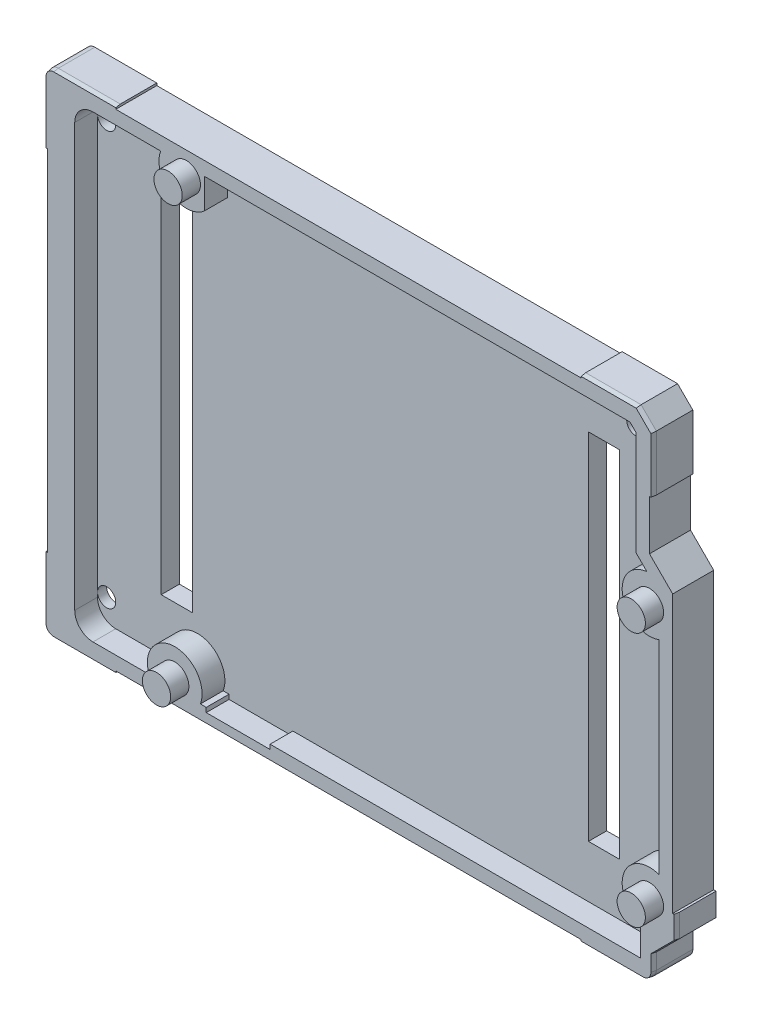
from build123d import *

# Parameters (mm, degrees)
BOSS_EXTRUDE1_START    = 3
SKETCH2_W              = 3.408239977
SKETCH2_H              = 38.899803488
BOSS_EXTRUDE1_DEPTH    = 2
BOSS_EXTRUDE2_START    = 0.5
BOSS_EXTRUDE2_DEPTH    = 4.5
BOSS_EXTRUDE3_START    = 0.5
SKETCH2_5_R            = 1.55
BOSS_EXTRUDE3_DEPTH    = 2
CHAMFER1_SIZE          = 0.1
CHAMFER1_SIZE2         = 0.5
SKETCH4_R              = 3.5
SKETCH4_R_2            = 1
CUT_EXTRUDE2_DEPTH     = 1
SKETCH4_3_R            = 1
CUT_EXTRUDE3_DEPTH     = 131.276716191
CUT_EXTRUDE4_START     = -0.1
CUT_EXTRUDE4_OUTLINE_W = 3.200622545
CUT_EXTRUDE4_OUTLINE_H = 1.015319288
CUT_EXTRUDE4_DEPTH     = 0.1
SKETCH6_W              = 51.040013568
SKETCH6_H              = 0.25
SKETCH6_W_2            = 0.25
SKETCH6_H_2            = 38.343270923
CUT_EXTRUDE5_DEPTH     = 131.276716313


# Read off the part's stored shape, not the designer's step: Cut-Extrude4
with BuildPart() as part:
    # Sketch2 → Boss-Extrude1 (new body)
    with BuildSketch(Plane(origin=(0, 0, 0), x_dir=(-1, 0, 0), z_dir=(0, 0, -1)).offset(BOSS_EXTRUDE1_START)):
        with BuildLine():
            ThreePointArc((-67.919679801, -18.097456736), (-70.732628511, -14.054710577), (-73.545577222, -18.097456736))
            Line((-73.545577222, -18.097456736), (-74.187108273, -18.097456736))
            Line((-74.187108273, -18.097456736), (-74.187108273, -18.597456736))
            Line((-74.187108273, -18.597456736), (-81.187108273, -18.597456736))
            Line((-81.187108273, -18.597456736), (-81.187108273, -18.097456736))
            Line((-81.187108273, -18.097456736), (-121.802642079, -18.097456736))
            Line((-121.802642079, -18.097456736), (-121.802642079, -14.803142498))
            ThreePointArc((-121.802642079, -14.803142498), (-119.981755466, -10.953595861), (-123.84481438, -9.161554233))
            Line((-123.84481438, -9.161554233), (-123.84481438, 13.152133079))
            ThreePointArc((-123.84481438, 13.152133079), (-119.877527751, 15.299117116), (-122.523862626, 18.952309608))
            Line((-122.523862626, 18.952309608), (-121.302642079, 20.173530155))
            Line((-121.302642079, 20.173530155), (-121.302642079, 31.599188818))
            Line((-121.302642079, 31.599188818), (-120.656018993, 32.245814187))
            Line((-120.656018993, 32.245814187), (-74.002628511, 32.245814187))
            Line((-74.002628511, 32.245814187), (-74.002628511, 28.969221446))
            ThreePointArc((-74.002628511, 28.969221446), (-70.314561309, 28.725283552), (-69.188857338, 32.245814187))
            Line((-69.188857338, 32.245814187), (-61.762628511, 32.245814187))
            ThreePointArc((-61.762628511, 32.245814187), (-60.348414949, 31.660027749), (-59.762628511, 30.245814187))
            Line((-59.762628511, 30.245814187), (-59.762628511, -16.097456736))
            ThreePointArc((-59.762628511, -16.097456736), (-60.348414949, -17.511670298), (-61.762628511, -18.097456736))
            Line((-61.762628511, -18.097456736), (-67.919679801, -18.097456736))
        make_face()
        with Locations((-115.31029451, 7.081240142)):
            Rectangle(SKETCH2_W, SKETCH2_H, mode=Mode.SUBTRACT)
        with Locations((-68.449565127, 7.081240142)):
            Rectangle(SKETCH2_W, SKETCH2_H, mode=Mode.SUBTRACT)
    extrude(amount=BOSS_EXTRUDE1_DEPTH)

    # Sketch2<3> → Boss-Extrude2 (add)
    with BuildSketch(Plane(origin=(0, 0, 0), x_dir=(-1, 0, 0), z_dir=(0, 0, -1)).offset(BOSS_EXTRUDE2_START)):
        with BuildLine():
            Line((-57.462628511, -19.847456736), (-122.102642079, -19.847456736))
            ThreePointArc((-122.102642079, -19.847456736), (-122.774393521, -19.569208178), (-123.052642079, -18.897456736))
            Line((-123.052642079, -18.897456736), (-123.052642079, -17.158837169))
            Line((-123.052642079, -17.158837169), (-125.59481438, -14.616663544))
            Line((-125.59481438, -14.616663544), (-125.59481438, 18.356231588))
            Line((-125.59481438, 18.356231588), (-123.052642079, 20.898403889))
            Line((-123.052642079, 20.898403889), (-123.052642079, 32.324060743))
            Line((-123.052642079, 32.324060743), (-121.380894537, 33.995814187))
            Line((-121.380894537, 33.995814187), (-57.462628511, 33.995814187))
            ThreePointArc((-57.462628511, 33.995814187), (-56.790877069, 33.717565629), (-56.512628511, 33.045814187))
            Line((-56.512628511, 33.045814187), (-56.512628511, -18.897456736))
            ThreePointArc((-56.512628511, -18.897456736), (-56.790877069, -19.569208178), (-57.462628511, -19.847456736))
        make_face()
        with BuildLine():
            Line((-61.762628511, 32.245814187), (-69.188857338, 32.245814187))
            ThreePointArc((-69.188857338, 32.245814187), (-70.314561309, 28.725283552), (-74.002628511, 28.969221446))
            Line((-74.002628511, 28.969221446), (-74.002628511, 32.245814187))
            Line((-74.002628511, 32.245814187), (-120.656018993, 32.245814187))
            Line((-120.656018993, 32.245814187), (-121.302642079, 31.599188818))
            Line((-121.302642079, 31.599188818), (-121.302642079, 20.173530155))
            Line((-121.302642079, 20.173530155), (-122.523862626, 18.952309608))
            ThreePointArc((-122.523862626, 18.952309608), (-119.877527751, 15.299117116), (-123.84481438, 13.152133079))
            Line((-123.84481438, 13.152133079), (-123.84481438, -9.161554233))
            ThreePointArc((-123.84481438, -9.161554233), (-119.981755466, -10.953595861), (-121.802642079, -14.803142498))
            Line((-121.802642079, -14.803142498), (-121.802642079, -18.097456736))
            Line((-121.802642079, -18.097456736), (-81.187108273, -18.097456736))
            Line((-81.187108273, -18.097456736), (-81.187108273, -18.597456736))
            Line((-81.187108273, -18.597456736), (-74.187108273, -18.597456736))
            Line((-74.187108273, -18.597456736), (-74.187108273, -18.097456736))
            Line((-74.187108273, -18.097456736), (-73.545577222, -18.097456736))
            ThreePointArc((-73.545577222, -18.097456736), (-70.732628511, -14.054710577), (-67.919679801, -18.097456736))
            Line((-67.919679801, -18.097456736), (-61.762628511, -18.097456736))
            ThreePointArc((-61.762628511, -18.097456736), (-60.348414949, -17.511670298), (-59.762628511, -16.097456736))
            Line((-59.762628511, -16.097456736), (-59.762628511, 30.245814187))
            ThreePointArc((-59.762628511, 30.245814187), (-60.348414949, 31.660027749), (-61.762628511, 32.245814187))
        make_face(mode=Mode.SUBTRACT)
    extrude(amount=BOSS_EXTRUDE2_DEPTH)

    # Sketch2<5> → Boss-Extrude3 (add)
    with BuildSketch(Plane(origin=(0, 0, 0), x_dir=(-1, 0, 0), z_dir=(0, 0, -1)).offset(BOSS_EXTRUDE3_START)):
        with Locations((-70.732628511, -17.054710577)):
            Circle(SKETCH2_5_R)
        with Locations((-122.802628511, -11.974710577)):
            Circle(SKETCH2_5_R)
        with Locations((-122.802628511, 15.965289423)):
            Circle(SKETCH2_5_R)
        with Locations((-72.002628511, 31.205289423)):
            Circle(SKETCH2_5_R)
    extrude(amount=-BOSS_EXTRUDE3_DEPTH)

    # Chamfer1
    chamfer1_edges = [part.edges().sort_by_distance(p)[0] for p in [
        (56.512628511, 7.074178726, -0.5),
        (56.790877069, 33.717565629, -0.5),
        (89.421761524, 33.995814187, -0.5),
        (122.216768308, 33.159937465, -0.5),
        (123.052642079, 26.611232316, -0.5),
        (124.32372823, 19.627317738, -0.5),
        (124.32372823, -15.887750356, -0.5),
        (123.052642079, -18.028146952, -0.5),
        (122.774393521, -19.569208178, -0.5),
        (56.790877069, -19.569208178, -0.5),
        (89.782635295, -19.847456736, -0.5),
        (125.59481438, 1.869784022, -0.5),
    ]]
    chamfer1_side = [part.faces().sort_by_distance(p)[0] for p in [
        (89.782635295, -18.97158881, -0.5),
    ]]
    chamfer(chamfer1_edges, length=CHAMFER1_SIZE, length2=CHAMFER1_SIZE2, reference=chamfer1_side[0])

    # Sketch4 → Cut-Extrude2 (cut)
    # profile 1 of 4: a face of its own
    with BuildSketch(Plane(origin=(0, 0, -5), x_dir=(-1, 0, 0), z_dir=(0, 0, -1))):
        with Locations((-118.802642079, 29.745814187)):
            Circle(SKETCH4_R)
        with Locations((-118.802642079, 29.745814187)):
            Circle(SKETCH4_R_2, mode=Mode.SUBTRACT)
    # profile 2 of 4: a face of its own
    with BuildSketch(Plane(origin=(0, 0, -5), x_dir=(-1, 0, 0), z_dir=(0, 0, -1))):
        with Locations((-60.762628511, 29.745814187)):
            Circle(SKETCH4_R)
        with Locations((-60.762628511, 29.745814187)):
            Circle(SKETCH4_R_2, mode=Mode.SUBTRACT)
    # profile 3 of 4: a face of its own
    with BuildSketch(Plane(origin=(0, 0, -5), x_dir=(-1, 0, 0), z_dir=(0, 0, -1))):
        with Locations((-60.762628511, -15.597456736)):
            Circle(SKETCH4_R)
        with Locations((-60.762628511, -15.597456736)):
            Circle(SKETCH4_R_2, mode=Mode.SUBTRACT)
    # profile 4 of 4: a face of its own
    with BuildSketch(Plane(origin=(0, 0, -5), x_dir=(-1, 0, 0), z_dir=(0, 0, -1))):
        with Locations((-118.802642079, -15.597456736)):
            Circle(SKETCH4_R)
        with Locations((-118.802642079, -15.597456736)):
            Circle(SKETCH4_R_2, mode=Mode.SUBTRACT)
    extrude(amount=-CUT_EXTRUDE2_DEPTH, mode=Mode.SUBTRACT)

    # Sketch4<3> → Cut-Extrude3 (cut, through all)
    with BuildSketch(Plane(origin=(0, 0, -5), x_dir=(-1, 0, 0), z_dir=(0, 0, -1))):
        with Locations((-118.802642079, 29.745814187)):
            Circle(SKETCH4_3_R)
        with Locations((-60.762628511, 29.745814187)):
            Circle(SKETCH4_3_R)
        with Locations((-60.762628511, -15.597456736)):
            Circle(SKETCH4_3_R)
        with Locations((-118.802642079, -15.597456736)):
            Circle(SKETCH4_3_R)
    extrude(amount=-CUT_EXTRUDE3_DEPTH, mode=Mode.SUBTRACT)

    # Cut-Extrude4 outline → Cut-Extrude4 (cut)
    # profile 1 of 3: a face of its own
    with BuildSketch(Plane(origin=(0, 0, -5), x_dir=(-1, 0, 0), z_dir=(0, 0, -1)).offset(CUT_EXTRUDE4_START)):
        with BuildLine():
            add(Edge.make_bspline(
                [(-91.879929818, 5.301013002), (-91.713250685, 5.05794433), (-91.340054452, 4.557222914), (-90.708052769, 3.842822143), (-89.973499097, 3.149696588), (-89.230729326, 2.635640492), (-88.566264307, 2.314810671), (-87.85216143, 2.069269468), (-86.966399982, 1.927397867), (-85.9097155, 1.915127625), (-84.813745024, 2.115417445), (-83.806418452, 2.537988583), (-83.041670905, 3.042729563), (-82.495530725, 3.560532924), (-82.023393492, 4.125901619), (-81.551856108, 4.899563642), (-81.23558079, 5.769800557), (-81.105349302, 6.507352899), (-81.085572249, 6.890959615), (-81.088140807, 7.081240145)],
                knots=[0.104390575, 0.104390575, 0.104390575, 0.104390575, 0.162006879, 0.226402489, 0.290798099, 0.355193708, 0.387391513, 0.419589318, 0.483984927, 0.548380537, 0.612776147, 0.677171756, 0.741567366, 0.773765171, 0.805962976, 0.870358585, 0.934754195, 0.966952, 0.999149805, 0.999149805, 0.999149805, 0.999149805], degree=3))
            add(Edge.make_bspline(
                [(-81.088140807, 7.081240145), (-81.08557225, 7.271520675), (-81.105349302, 7.65512739), (-81.23558079, 8.392679733), (-81.551856109, 9.262916648), (-82.023393494, 10.03657867), (-82.495530727, 10.601947365), (-83.041670908, 11.119750726), (-83.806418455, 11.624491705), (-84.813745027, 12.047062842), (-85.909715503, 12.247352661), (-86.966399986, 12.235082419), (-87.852161433, 12.093210818), (-88.56626431, 11.847669614), (-89.230729329, 11.526839792), (-89.9734991, 11.012783696), (-90.708052772, 10.319658141), (-91.340054453, 9.60525737), (-91.713250686, 9.104535954), (-91.879929818, 8.861467283)],
                knots=[-0.03117995, -0.03117995, -0.03117995, -0.03117995, 0.001017855, 0.03321566, 0.09761127, 0.162006879, 0.194204684, 0.226402489, 0.290798099, 0.355193708, 0.419589318, 0.483984927, 0.548380537, 0.580578342, 0.612776147, 0.677171756, 0.741567366, 0.805962976, 0.86357928, 0.86357928, 0.86357928, 0.86357928], degree=3))
            add(Edge.make_bspline(
                [(-91.879929818, 8.861467283), (-92.046608951, 9.104535954), (-92.419805183, 9.60525737), (-93.051806865, 10.319658141), (-93.786360536, 11.012783696), (-94.529130307, 11.526839792), (-95.193595327, 11.847669613), (-95.907698204, 12.093210818), (-96.793459651, 12.235082419), (-97.850144133, 12.247352661), (-98.946114609, 12.047062842), (-99.953441182, 11.624491705), (-100.718188728, 11.119750726), (-101.264328909, 10.601947365), (-101.736466143, 10.03657867), (-102.208003527, 9.262916648), (-102.524278846, 8.392679733), (-102.654510334, 7.65512739), (-102.674287387, 7.271520675), (-102.671718829, 7.081240145)],
                knots=[0.104390575, 0.104390575, 0.104390575, 0.104390575, 0.162006879, 0.226402489, 0.290798099, 0.355193708, 0.387391513, 0.419589318, 0.483984927, 0.548380537, 0.612776147, 0.677171756, 0.741567366, 0.773765171, 0.805962976, 0.870358585, 0.934754195, 0.966952, 0.999149805, 0.999149805, 0.999149805, 0.999149805], degree=3))
            add(Edge.make_bspline(
                [(-102.671718829, 7.081240145), (-102.674287387, 6.890959614), (-102.654510335, 6.507352899), (-102.524278847, 5.769800557), (-102.208003529, 4.899563641), (-101.736466144, 4.125901619), (-101.264328911, 3.560532924), (-100.718188731, 3.042729562), (-99.953441184, 2.537988583), (-98.946114612, 2.115417445), (-97.850144136, 1.915127625), (-96.793459654, 1.927397867), (-95.907698207, 2.069269468), (-95.19359533, 2.314810671), (-94.52913031, 2.635640492), (-93.786360539, 3.149696588), (-93.051806867, 3.842822143), (-92.419805184, 4.557222914), (-92.046608951, 5.05794433), (-91.879929818, 5.301013002)],
                knots=[-0.03117995, -0.03117995, -0.03117995, -0.03117995, 0.001017855, 0.03321566, 0.09761127, 0.162006879, 0.194204684, 0.226402489, 0.290798099, 0.355193708, 0.419589318, 0.483984927, 0.548380537, 0.580578342, 0.612776147, 0.677171756, 0.741567366, 0.805962976, 0.86357928, 0.86357928, 0.86357928, 0.86357928], degree=3))
        make_face()
        with BuildLine():
            add(Edge.make_bspline(
                [(-100.871487153, 7.081240142), (-100.871536386, 7.07833104), (-100.87168791, 7.069318558), (-100.872520605, 7.021124128), (-100.871455856, 6.910493686), (-100.856835343, 6.702338799), (-100.798051885, 6.325678204), (-100.624144549, 5.796477525), (-100.280132446, 5.185004458), (-99.848849782, 4.668641648), (-99.325155173, 4.26738537), (-98.694041594, 3.949881939), (-98.049615841, 3.766838333), (-97.357881067, 3.71080866), (-96.618232253, 3.767321832), (-95.9776606, 3.925789013), (-95.376480646, 4.228132078), (-94.806562629, 4.656376401), (-94.255861361, 5.193790714), (-93.577829752, 5.978803356), (-93.144131127, 6.628013319), (-92.894065857, 7.081240142)],
                knots=[0.034722485, 0.034722485, 0.034722485, 0.034722485, 0.035521766, 0.036054621, 0.049821598, 0.064920711, 0.095118936, 0.155515388, 0.215911839, 0.276308291, 0.336704742, 0.397101194, 0.457497645, 0.517894097, 0.578290548, 0.638687, 0.699083451, 0.759479903, 0.819876354, 0.880272806, 1.001065709, 1.001065709, 1.001065709, 1.001065709], degree=3))
            add(Edge.make_bspline(
                [(-92.894065857, 7.081240142), (-93.144131127, 7.534466964), (-93.577829752, 8.183676927), (-94.255861361, 8.96868957), (-94.806562629, 9.506103883), (-95.376480646, 9.934348206), (-95.9776606, 10.23669127), (-96.618232253, 10.395158451), (-97.357881067, 10.451671623), (-98.049615841, 10.39564195), (-98.694041594, 10.212598345), (-99.325155173, 9.895094913), (-99.848849782, 9.493838636), (-100.280132446, 8.977475825), (-100.624144549, 8.366002758), (-100.798051885, 7.836802079), (-100.856835343, 7.460141485), (-100.871455856, 7.251986598), (-100.872520605, 7.141356156), (-100.87168791, 7.093161725), (-100.871536386, 7.084149244), (-100.871487153, 7.081240142)],
                knots=[0.034722485, 0.034722485, 0.034722485, 0.034722485, 0.155515388, 0.215911839, 0.276308291, 0.336704742, 0.397101194, 0.457497645, 0.517894097, 0.578290548, 0.638687, 0.699083451, 0.759479903, 0.819876354, 0.880272806, 0.940669257, 0.970867483, 0.985966596, 0.999733573, 1.000266427, 1.001065709, 1.001065709, 1.001065709, 1.001065709], degree=3))
        make_face(mode=Mode.SUBTRACT)
        with BuildLine():
            add(Edge.make_bspline(
                [(-82.888372484, 7.081240142), (-82.88832325, 7.084149244), (-82.888171726, 7.093161725), (-82.887339031, 7.141356156), (-82.88840378, 7.251986598), (-82.903024294, 7.460141485), (-82.961807752, 7.836802079), (-83.135715087, 8.366002758), (-83.479727191, 8.977475825), (-83.911009855, 9.493838636), (-84.434704463, 9.895094913), (-85.065818042, 10.212598345), (-85.710243795, 10.39564195), (-86.401978569, 10.451671623), (-87.141627383, 10.395158451), (-87.782199036, 10.23669127), (-88.383378991, 9.934348206), (-88.953297007, 9.506103883), (-89.503998275, 8.96868957), (-90.182029884, 8.183676927), (-90.615728509, 7.534466964), (-90.865793779, 7.081240142)],
                knots=[0.034722485, 0.034722485, 0.034722485, 0.034722485, 0.035521766, 0.036054621, 0.049821598, 0.064920711, 0.095118936, 0.155515388, 0.215911839, 0.276308291, 0.336704742, 0.397101194, 0.457497645, 0.517894097, 0.578290548, 0.638687, 0.699083451, 0.759479903, 0.819876354, 0.880272806, 1.001065709, 1.001065709, 1.001065709, 1.001065709], degree=3))
            add(Edge.make_bspline(
                [(-90.865793779, 7.081240142), (-90.615728509, 6.628013319), (-90.182029884, 5.978803356), (-89.503998275, 5.193790714), (-88.953297007, 4.656376401), (-88.383378991, 4.228132078), (-87.782199036, 3.925789013), (-87.141627383, 3.767321832), (-86.401978569, 3.71080866), (-85.710243795, 3.766838333), (-85.065818042, 3.949881939), (-84.434704463, 4.26738537), (-83.911009855, 4.668641648), (-83.479727191, 5.185004458), (-83.135715087, 5.796477525), (-82.961807752, 6.325678204), (-82.903024294, 6.702338799), (-82.88840378, 6.910493686), (-82.887339031, 7.021124128), (-82.888171726, 7.069318558), (-82.88832325, 7.07833104), (-82.888372484, 7.081240142)],
                knots=[0.034722485, 0.034722485, 0.034722485, 0.034722485, 0.155515388, 0.215911839, 0.276308291, 0.336704742, 0.397101194, 0.457497645, 0.517894097, 0.578290548, 0.638687, 0.699083451, 0.759479903, 0.819876354, 0.880272806, 0.940669257, 0.970867483, 0.985966596, 0.999733573, 1.000266427, 1.001065709, 1.001065709, 1.001065709, 1.001065709], degree=3))
        make_face(mode=Mode.SUBTRACT)
    # profile 2 of 3: a face of its own
    with BuildSketch(Plane(origin=(0, 0, -5), x_dir=(-1, 0, 0), z_dir=(0, 0, -1)).offset(CUT_EXTRUDE4_START)):
        with Locations((-97.261442232, 7.233303401)):
            Rectangle(CUT_EXTRUDE4_OUTLINE_W, CUT_EXTRUDE4_OUTLINE_H)
    # profile 3 of 3: a face of its own
    with BuildSketch(Plane(origin=(0, 0, -5), x_dir=(-1, 0, 0), z_dir=(0, 0, -1)).offset(CUT_EXTRUDE4_START)):
        Polygon((-88.09977143, 7.740963045), (-88.09977143, 6.725643757), (-87.140008285, 6.725643757), (-87.140008285, 5.765880612), (-86.124688997, 5.765880612), (-86.124688997, 6.725643757), (-85.164925852, 6.725643757), (-85.164925852, 7.740963045), (-86.124688997, 7.740963045), (-86.124688997, 8.700726189), (-87.140008285, 8.700726189), (-87.140008285, 7.740963045), align=None)
    extrude(amount=CUT_EXTRUDE4_DEPTH, mode=Mode.SUBTRACT)

    # Sketch6 → Cut-Extrude5 (cut, through all)
    with BuildSketch(Plane(origin=(0, 0, -5), x_dir=(-1, 0, 0), z_dir=(0, 0, -1))):
        Polygon((-122.802642079, 26.245814187), (-123.052642079, 26.245814187), (-123.052642079, 20.898403889), (-125.59481438, 18.356231588), (-125.59481438, -12.097456736), (-125.34481438, -12.097456736), (-125.34481438, 18.252678197), (-122.802642079, 20.794850498), align=None)
        with Locations((-89.782635295, 33.870814187)):
            Rectangle(SKETCH6_W, SKETCH6_H)
        with Locations((-56.637628511, 7.074178725)):
            Rectangle(SKETCH6_W_2, SKETCH6_H_2)
        with Locations((-89.782635295, -19.722456736)):
            Rectangle(SKETCH6_W, SKETCH6_H)
    extrude(amount=-CUT_EXTRUDE5_DEPTH, mode=Mode.SUBTRACT)


solid = part.part
